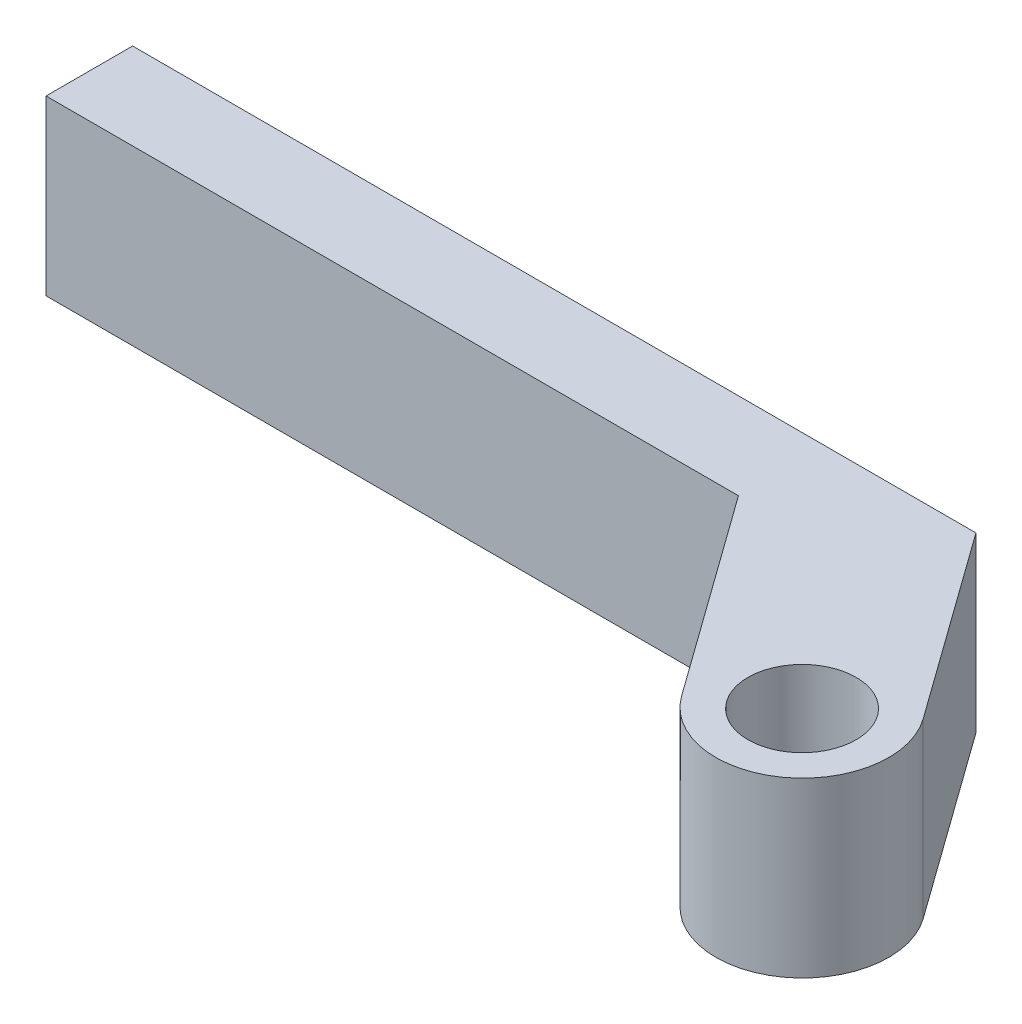
from build123d import *

# Parameters (mm, degrees)
BOSS_EXTRUDE1_DEPTH         = 12.7
F_3_8_16_TAPPED_HOLE1_D     = 7.9375
F_3_8_16_TAPPED_HOLE1_DEPTH = 6.35
F_3_8_16_TAPPED_HOLE1_TIP   = 2.384665582


with BuildPart() as part:
    # Sketch2 → Boss-Extrude1 (new body)
    with BuildSketch(Plane(origin=(0, 0, 0), x_dir=(1, 0, 0), z_dir=(0, 1, 0))):
        with BuildLine():
            Line((-10.638933845, -0.317978242), (0.0062465, -15.135448057))
            ThreePointArc((0.0062465, -15.135448057), (8.868318086, -16.587580012), (10.320450041, -7.725508427))
            Line((10.320450041, -7.725508427), (0.436752504, 6.032021758))
            Line((0.436752504, 6.032021758), (-10.638933845, 6.032021758))
            Line((-10.638933845, 6.032021758), (-61.438933845, 6.032021758))
            Line((-61.438933845, 6.032021758), (-61.438933845, -0.317978242))
            Line((-61.438933845, -0.317978242), (-10.638933845, -0.317978242))
        make_face()
    extrude(amount=BOSS_EXTRUDE1_DEPTH)

    # 3/8-16 Tapped Hole1
    with Locations(Plane(origin=(0, 12.7, 0), x_dir=(1, 0, 0), z_dir=(0, 1, 0))):
        with Locations((5.218739795, -11.507580012)):
            Hole(F_3_8_16_TAPPED_HOLE1_D / 2, depth=F_3_8_16_TAPPED_HOLE1_DEPTH)
            with Locations((0, 0, -(F_3_8_16_TAPPED_HOLE1_DEPTH + F_3_8_16_TAPPED_HOLE1_TIP / 2))):  # 118° drill point
                Cone(0, F_3_8_16_TAPPED_HOLE1_D / 2, F_3_8_16_TAPPED_HOLE1_TIP, mode=Mode.SUBTRACT)


solid = part.part
